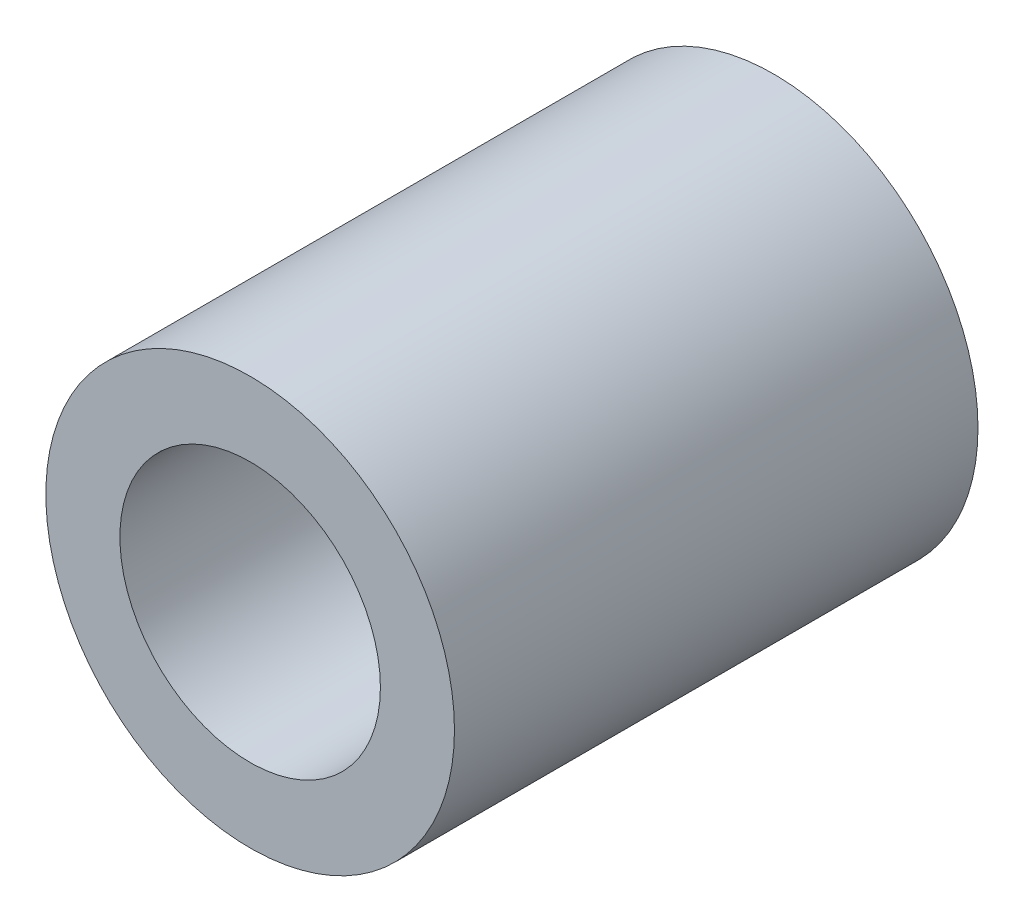
from build123d import *

# Parameters (mm, degrees)
SKETCH1_R           = 8
BOSS_EXTRUDE1_DEPTH = 20.5
SKETCH2_R           = 5.1
CUT_EXTRUDE1_DEPTH  = 13
CUT_EXTRUDE2_DEPTH  = 24.414738948


with BuildPart() as part:
    # Sketch1 → Boss-Extrude1 (new body)
    with BuildSketch(Plane.XY):
        Circle(SKETCH1_R)
    extrude(amount=BOSS_EXTRUDE1_DEPTH)

    # Sketch2 → Cut-Extrude1 (cut)
    with BuildSketch(Plane.XY.offset(20.5)):
        Circle(SKETCH2_R)
    extrude(amount=-CUT_EXTRUDE1_DEPTH, mode=Mode.SUBTRACT)

    # Sketch3 → Cut-Extrude2 (cut, through all)
    with BuildSketch(Plane(origin=(0, 0, 0), x_dir=(-1, 0, 0), z_dir=(0, 0, -1))):
        with BuildLine():
            Line((-0.948683298, 1.35), (0.948683298, 1.35))
            ThreePointArc((0.948683298, 1.35), (0, -1.65), (-0.948683298, 1.35))
        make_face()
    extrude(amount=-CUT_EXTRUDE2_DEPTH, mode=Mode.SUBTRACT)


solid = part.part
